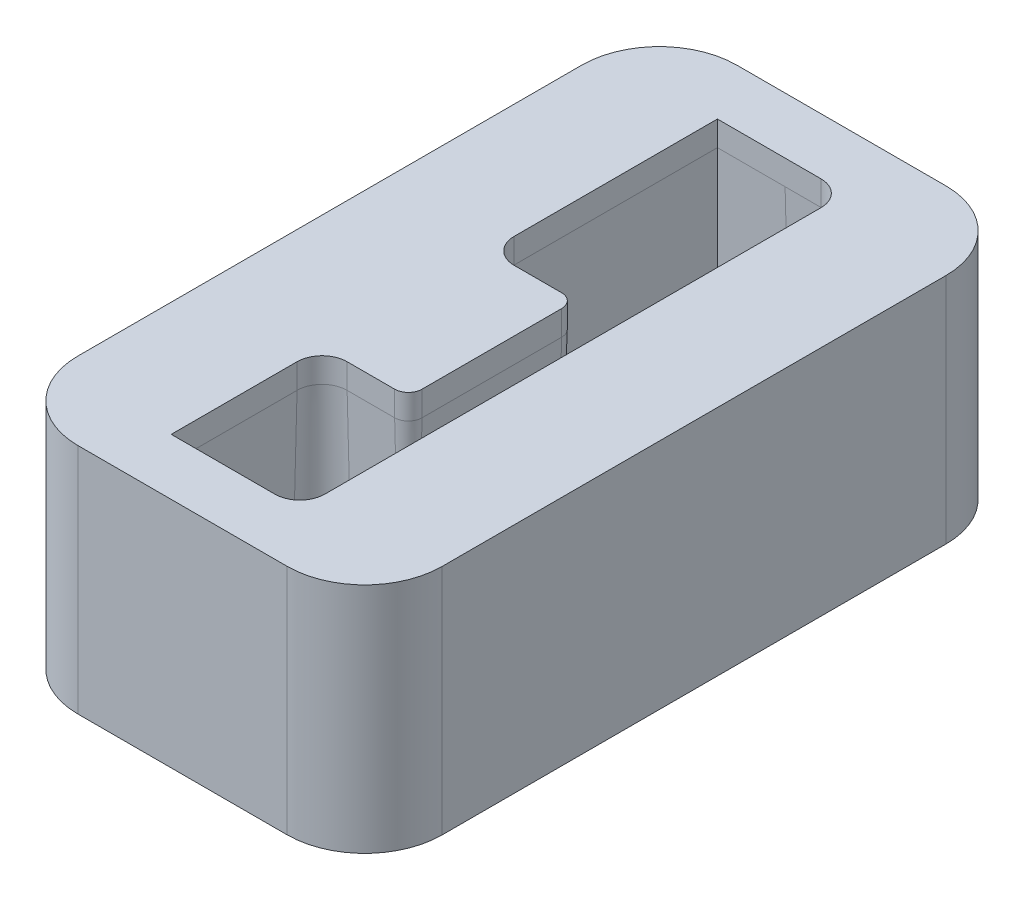
from build123d import *

# Parameters (mm, degrees)
SKETCH1_W           = 47
SKETCH1_H           = 85
BOSS_EXTRUDE1_DEPTH = 30
FILLET1_R           = 10
CUT_EXTRUDE1_REACH  = 59.083


with BuildPart() as part:
    # Sketch1 → Boss-Extrude1 (new body)
    with BuildSketch(Plane(origin=(0, 0, 0), x_dir=(1, 0, 0), z_dir=(0, 1, 0))):
        Rectangle(SKETCH1_W, SKETCH1_H)
    extrude(amount=-BOSS_EXTRUDE1_DEPTH)

    # Fillet1
    fillet1_edges = [part.edges().sort_by_distance(p)[0] for p in [
        (-23.5, -15, -42.5),
        (23.5, -15, -42.5),
        (-23.5, -15, 42.5),
        (23.5, -15, 42.5),
    ]]
    fillet(fillet1_edges, radius=FILLET1_R)

    # Sketch3 → Cut-Extrude1 (cut, up to next)
    with BuildSketch(Plane(origin=(0, 0, 0), x_dir=(1, 0, 0), z_dir=(0, 1, 0)), mode=Mode.PRIVATE) as cut_extrude1_sk1:
        with BuildLine():
            Line((4.63, 35.23), (-8.73, 35.23))
            Line((-8.73, 35.23), (-8.73, 9))
            ThreePointArc((-8.73, 9), (-7.783954903, 6.716045097), (-5.5, 5.77))
            Line((-5.5, 5.77), (0.63, 5.77))
            ThreePointArc((0.63, 5.77), (1.881579003, 5.251579003), (2.4, 4))
            Line((2.4, 4), (2.4, -14))
            ThreePointArc((2.4, -14), (1.881579003, -15.251579003), (0.63, -15.77))
            Line((0.63, -15.77), (-5.5, -15.77))
            ThreePointArc((-5.5, -15.77), (-7.783954903, -16.716045097), (-8.73, -19))
            Line((-8.73, -19), (-8.73, -35.23))
            Line((-8.73, -35.23), (4.63, -35.23))
            ThreePointArc((4.63, -35.23), (6.913954903, -34.283954903), (7.86, -32))
            Line((7.86, -32), (7.86, 32))
            ThreePointArc((7.86, 32), (6.913954903, 34.283954903), (4.63, 35.23))
        make_face()
    cut_extrude1_tool1 = extrude(cut_extrude1_sk1.sketch, amount=-CUT_EXTRUDE1_REACH, mode=Mode.PRIVATE) & part.part
    add(cut_extrude1_tool1.solids().sort_by_distance((6.402103, 0, -33.772103))[0], mode=Mode.SUBTRACT)

    # Cut-Sweep1: sweep along a path in Sketch5
    with BuildLine(Plane(origin=(0, 0, 0), x_dir=(1, 0, 0), z_dir=(0, 1, 0))) as cut_sweep1_path:
        Line((-8.73, -35.23), (4.63, -35.23))
        ThreePointArc((4.63, -35.23), (6.913954903, -34.283954903), (7.86, -32))
        Line((7.86, -32), (7.86, 32))
        ThreePointArc((7.86, 32), (6.913954903, 34.283954903), (4.63, 35.23))
        Line((4.63, 35.23), (-8.73, 35.23))
        Line((-8.73, 35.23), (-8.73, 9))
        ThreePointArc((-8.73, 9), (-7.783954903, 6.716045097), (-5.5, 5.77))
        Line((-5.5, 5.77), (0.63, 5.77))
        ThreePointArc((0.63, 5.77), (1.881579003, 5.251579003), (2.4, 4))
        Line((2.4, 4), (2.4, -14))
        ThreePointArc((2.4, -14), (1.881579003, -15.251579003), (0.63, -15.77))
        Line((0.63, -15.77), (-5.5, -15.77))
        ThreePointArc((-5.5, -15.77), (-7.783954903, -16.716045097), (-8.73, -19))
        Line((-8.73, -19), (-8.73, -35.23))
    # Sketch4 → Cut-Sweep1 (sweep, cut)
    with BuildSketch(Plane(origin=(0, 0, 0), x_dir=(0, 0, -1), z_dir=(1, 0, 0))):
        Polygon((35.23, -3.2), (35.931782698, -30), (35.23, -30), align=None)
    sweep(path=cut_sweep1_path.line, transition=Transition.RIGHT, mode=Mode.SUBTRACT)


solid = part.part
